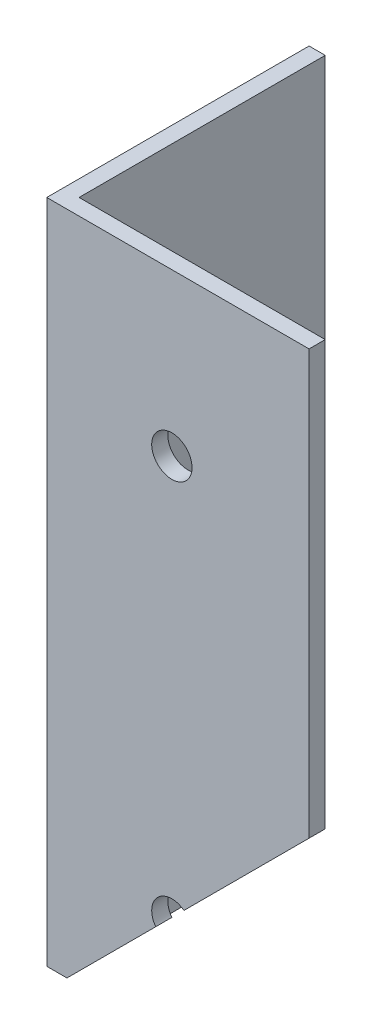
from build123d import *

# Parameters (mm, degrees)
EXTRUDE_1_DEPTH     = 165
SKETCH_2_R          = 5
CUT_EXTRUDE_1_DEPTH = 10
SKETCH_3_R          = 5
CUT_EXTRUDE_2_DEPTH = 10
CUT_EXTRUDE_3_DEPTH = 189.878267675


with BuildPart() as part:
    # Эскиз1 → Вытянуть-Тонкостенный1 (new body)
    with BuildSketch(Plane(origin=(0, 0, 0), x_dir=(1, 0, 0), z_dir=(0, 1, 0))):
        Polygon((0, 65), (0, 0), (65, 0), (65, 4), (4, 4), (4, 65), align=None)
    extrude(amount=EXTRUDE_1_DEPTH)

    # Эскиз2 → Вырез-Вытянуть1 (cut)
    with BuildSketch(Plane.XY):
        with Locations((31, 225)):
            Circle(SKETCH_2_R)
        with Locations((31, 125)):
            Circle(SKETCH_2_R)
        with Locations((31, 25)):
            Circle(SKETCH_2_R)
    extrude(amount=-CUT_EXTRUDE_1_DEPTH, mode=Mode.SUBTRACT)

    # Эскиз3 → Вырез-Вытянуть2 (cut)
    with BuildSketch(Plane.ZY):
        with Locations((-31, 225)):
            Circle(SKETCH_3_R)
        with Locations((-31, 125)):
            Circle(SKETCH_3_R)
        with Locations((-31, 25)):
            Circle(SKETCH_3_R)
    extrude(amount=-CUT_EXTRUDE_2_DEPTH, mode=Mode.SUBTRACT)

    # Эскиз4 → Вырез-Вытянуть3 (cut, through all)
    with BuildSketch(Plane.XY):
        Polygon((5, 0), (65, 60), (65, 0), align=None)
    extrude(amount=-CUT_EXTRUDE_3_DEPTH, mode=Mode.SUBTRACT)


solid = part.part
